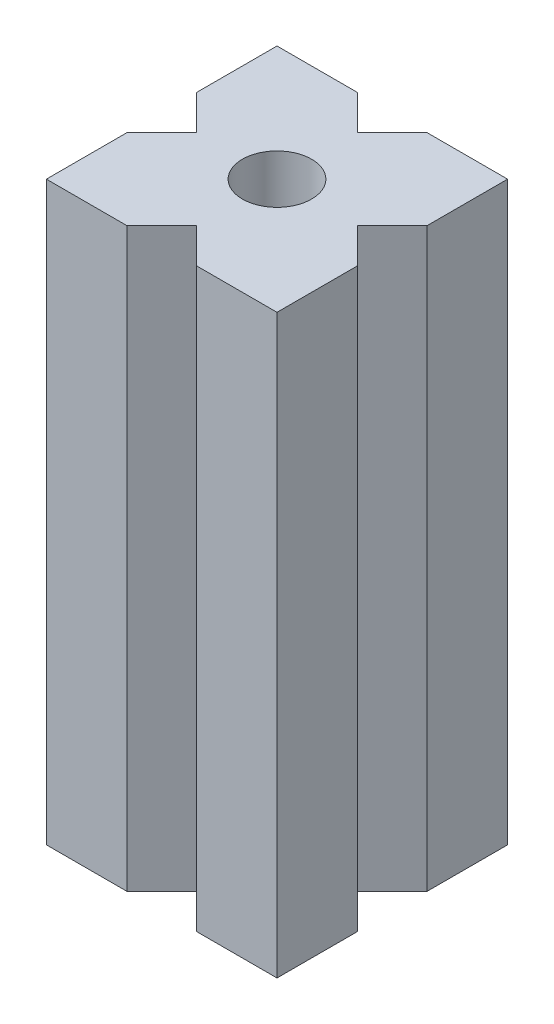
from build123d import *

# Parameters (mm, degrees)
SKIZZE1_W                       = 20
SKIZZE1_H                       = 20
AUFSATZ_LINEAR_AUSTRAGEN1_DEPTH = 25
SCHNITT_LINEAR_AUSTRAGEN1_DEPTH = 52.961524227
SKIZZE3_R                       = 3
SCHNITT_LINEAR_AUSTRAGEN2_DEPTH = 52.961524227


with BuildPart() as part:
    # Skizze1 → Aufsatz-Linear austragen1 (new, symmetric)
    with BuildSketch(Plane(origin=(0, 0, 0), x_dir=(1, 0, 0), z_dir=(0, 1, 0))):
        Rectangle(SKIZZE1_W, SKIZZE1_H)
    extrude(amount=AUFSATZ_LINEAR_AUSTRAGEN1_DEPTH, both=True)

    # Skizze2 → Schnitt-Linear austragen1 (cut, through all)
    with BuildSketch(Plane(origin=(0, 25, 0), x_dir=(1, 0, 0), z_dir=(0, 1, 0))):
        Polygon((-3, 10), (0, 7), (3, 10), align=None)
        Polygon((10, 3), (7, 0), (10, -3), align=None)
        Polygon((-10, -3), (-10, 3), (-7, 0), align=None)
        Polygon((-3, -10), (3, -10), (0, -7), align=None)
    extrude(amount=-SCHNITT_LINEAR_AUSTRAGEN1_DEPTH, mode=Mode.SUBTRACT)

    # Skizze3 → Schnitt-Linear austragen2 (cut, through all)
    with BuildSketch(Plane(origin=(0, 25, 0), x_dir=(1, 0, 0), z_dir=(0, 1, 0))):
        Circle(SKIZZE3_R)
    extrude(amount=-SCHNITT_LINEAR_AUSTRAGEN2_DEPTH, mode=Mode.SUBTRACT)


solid = part.part
